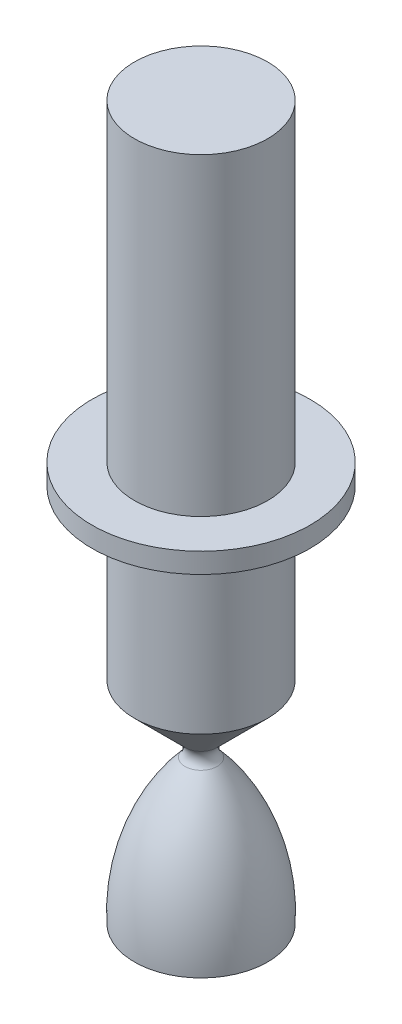
from build123d import *

# Parameters (mm, degrees)
SKETCH2_W = 17
SKETCH2_H = 80


with BuildPart() as part:
    # Sketch1 → Revolve1 (revolve)
    with BuildSketch(Plane.XY):
        with BuildLine():
            Line((0, 0), (17, 0))
            ThreePointArc((17, 0), (14.146372017, 19.654148519), (4.091449674, 36.780948668))
            ThreePointArc((4.091449674, 36.780948668), (3.223460565, 38.876459746), (4.091449674, 40.971970825))
            Line((4.091449674, 40.971970825), (17, 53.880521151))
            Line((17, 53.880521151), (17, 96.852266261))
            Line((17, 96.852266261), (27.840575234, 96.852266261))
            Line((27.840575234, 96.852266261), (27.840575234, 102))
            Line((27.840575234, 102), (0, 102))
            Line((0, 102), (0, 0))
        make_face()
    revolve(axis=Axis((0, 0, 0), (0, 1, 0)))

    # Sketch2 → Revolve3 (revolve)
    with BuildSketch(Plane.XY):
        with Locations((8.5, 142)):
            Rectangle(SKETCH2_W, SKETCH2_H)
    revolve(axis=Axis((0, 102, 0), (0, 1, 0)))


solid = part.part
